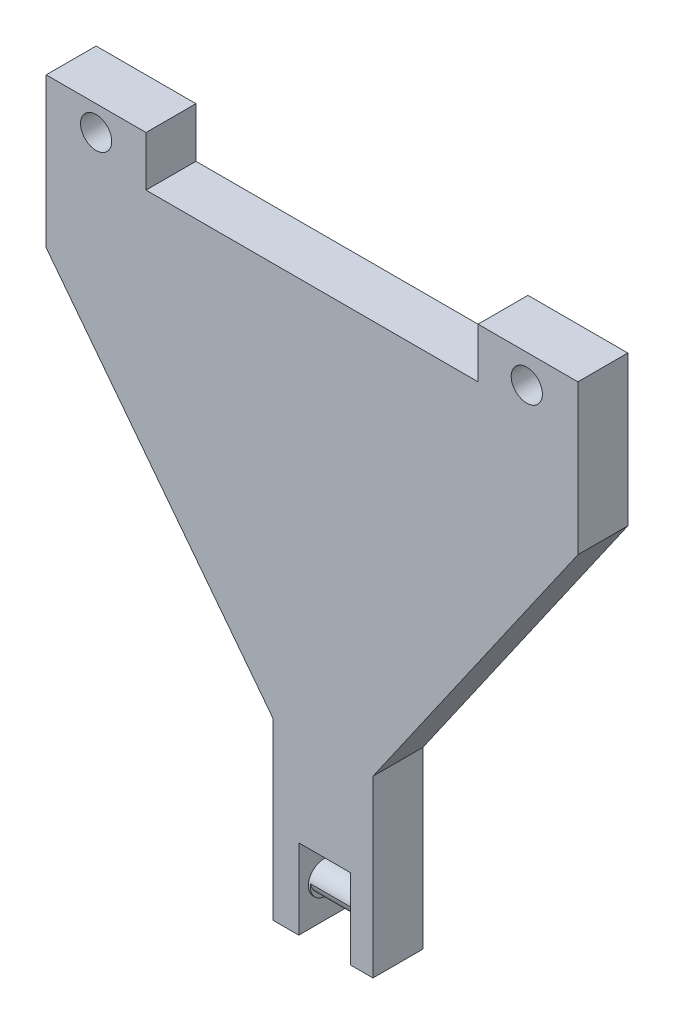
from build123d import *

# Parameters (mm, degrees)
BOSS_EXTRUDE1_DEPTH = 5.08
SKETCH2_R           = 1.5875
CUT_EXTRUDE1_DEPTH  = 50.083323044
SKETCH3_R           = 1.5875
CUT_EXTRUDE2_DEPTH  = 50.083323044
CAVITY1_START       = -1.349094449
CAVITY1_OUTLINE_R   = 1.5875
CAVITY1_DEPTH       = 5.08
CUT_EXTRUDE4_DEPTH  = 50.083323044
CAVITY3_START       = -1.147520379
CAVITY3_OUTLINE_R   = 1.5875
CAVITY3_DEPTH       = 5.08
CUT_EXTRUDE5_DEPTH  = 0.20157407


# Read off the part's stored shape, not the designer's step: Cavity1, Cavity3
with BuildPart() as part:
    # Sketch1 → Boss-Extrude1 (new body)
    with BuildSketch(Plane.XY):
        Polygon((-27.051, 40.64), (-16.891, 40.64), (-16.891, 35.56), (16.891, 35.56), (16.891, 40.64), (27.051, 40.64), (27.051, 30.48), (27.051, -40.64), (-27.051, -40.64), (-27.051, 30.48), align=None)
    extrude(amount=BOSS_EXTRUDE1_DEPTH)

    # Sketch2 → Cut-Extrude1 (cut, through all)
    with BuildSketch(Plane.XY.offset(5.08)):
        with Locations((-21.971, 38.1)):
            Circle(SKETCH2_R)
    extrude(amount=-CUT_EXTRUDE1_DEPTH, mode=Mode.SUBTRACT)

    # Sketch3 → Cut-Extrude2 (cut, through all)
    with BuildSketch(Plane(origin=(0, 0, 0), x_dir=(-1, 0, 0), z_dir=(0, 0, -1))):
        with Locations((-21.851181845, 37.741299139)):
            Circle(SKETCH3_R)
    extrude(amount=-CUT_EXTRUDE2_DEPTH, mode=Mode.SUBTRACT)

    # Cavity1 outline → Cavity1 (cut)
    with BuildSketch(Plane.YZ.offset(CAVITY1_START)):
        with BuildLine():
            Line((-14.704392822, 5.08), (-26.073978973, 5.08))
            ThreePointArc((-26.073978973, 5.08), (-25.829625006, 2.541825867), (-25.626750522, 0))
            Line((-25.626750522, 0), (-12.865436781, 0))
            ThreePointArc((-12.865436781, 0), (-13.763940636, 2.547592632), (-14.704392822, 5.08))
        make_face()
        with Locations((-18.456090827, 2.518577165)):
            Circle(CAVITY1_OUTLINE_R, mode=Mode.SUBTRACT)
    extrude(amount=CAVITY1_DEPTH, mode=Mode.SUBTRACT)

    # Sketch4 → Cut-Extrude4 (cut, through all)
    with BuildSketch(Plane.XY.offset(5.08)):
        Polygon((-3.962834865, -4.544614252), (-27.051, 25.4), (-27.051, -40.64), (27.051, -40.64), (27.051, 25.4), (6.197256749, -4.544614252), (6.197256749, -22.324614252), (3.730905551, -22.324614252), (3.730905551, -26.073978973), (-1.349094449, -26.073978973), (-1.349094449, -22.324614252), (-3.962834865, -22.324614252), align=None)
    extrude(amount=-CUT_EXTRUDE4_DEPTH, mode=Mode.SUBTRACT)


with BuildPart() as cut_extrude4_kept_piece:
    # of the separate pieces the step leaves, the one the design keeps (cut_extrude4_pieces_kept)
    add(part.part.solids().sort_by_distance((-27.051, 40.64, 0))[0])

    # Cavity3 outline → Cavity3 (cut)
    with BuildSketch(Plane.YZ.offset(CAVITY3_START)):
        with BuildLine():
            ThreePointArc((-12.347244957, 0), (-13.245748811, 2.547592632), (-14.186200998, 5.08))
            Line((-14.186200998, 5.08), (-22.324614252, 5.08))
            Line((-22.324614252, 5.08), (-22.324614252, 0))
            Line((-22.324614252, 0), (-12.347244957, 0))
        make_face()
        with Locations((-17.937899002, 2.518577165)):
            Circle(CAVITY3_OUTLINE_R, mode=Mode.SUBTRACT)
    extrude(amount=CAVITY3_DEPTH, mode=Mode.SUBTRACT)

    # Sketch7 → Cut-Extrude5 (cut)
    with BuildSketch(Plane(origin=(-1.147520379, 0, 0), x_dir=(0, 0, -1), z_dir=(1, 0, 0))):
        Polygon((-5.08, -14.186200998), (0, -12.347244957), (0, -12.865436781), (-5.08, -14.704392822), align=None)
    extrude(amount=-CUT_EXTRUDE5_DEPTH, mode=Mode.SUBTRACT)


solid = cut_extrude4_kept_piece.part
